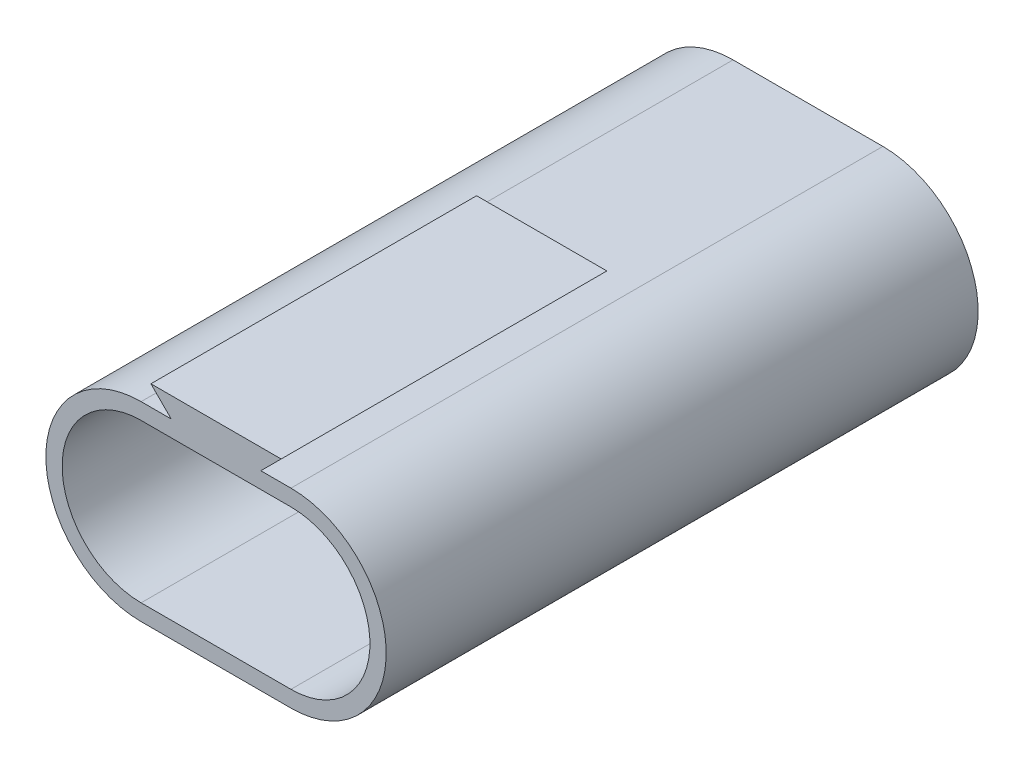
from build123d import *

# Parameters (mm, degrees)
Y_KSEKLIK_EKSTR_ZYON1_DEPTH = 70.2
Y_KSEKLIK_EKSTR_ZYON2_START = 2.5
Y_KSEKLIK_EKSTR_ZYON2_DEPTH = 2.5
Y_KSEKLIK_EKSTR_ZYON5_DEPTH = 40
PAH1_SIZE                   = 2.5
KES_EKSTR_ZYON1_DEPTH       = 10


with BuildPart() as part:
    # Çizim1 → Yükseklik-Ekstrüzyon1 (new body)
    with BuildSketch(Plane.XY):
        with BuildLine():
            Line((0, 11.7), (18.4, 11.7))
            ThreePointArc((18.4, 11.7), (30.1, 0), (18.4, -11.7))
            Line((18.4, -11.7), (0, -11.7))
            ThreePointArc((0, -11.7), (-11.7, 0), (0, 11.7))
        make_face()
        with BuildLine():
            ThreePointArc((0, 9.7), (-9.7, 0), (0, -9.7))
            Line((0, -9.7), (18.4, -9.7))
            ThreePointArc((18.4, -9.7), (28.1, 0), (18.4, 9.7))
            Line((18.4, 9.7), (0, 9.7))
        make_face(mode=Mode.SUBTRACT)
    extrude(amount=Y_KSEKLIK_EKSTR_ZYON1_DEPTH)

    # Çizim2 → Yükseklik-Ekstrüzyon2 (add)
    with BuildSketch(Plane(origin=(0, 0, 0), x_dir=(-1, 0, 0), z_dir=(0, 0, -1)).offset(Y_KSEKLIK_EKSTR_ZYON2_START)):
        with BuildLine():
            Line((0, 11.7), (-18.4, 11.7))
            ThreePointArc((-18.4, 11.7), (-30.1, 0), (-18.4, -11.7))
            Line((-18.4, -11.7), (0, -11.7))
            ThreePointArc((0, -11.7), (11.7, 0), (0, 11.7))
        make_face()
    extrude(amount=-Y_KSEKLIK_EKSTR_ZYON2_DEPTH)

    # Çizim8 → Yükseklik-Ekstrüzyon5 (add)
    with BuildSketch(Plane.XY.offset(70.2)):
        Polygon((14.7, 11.7), (3.7, 11.7), (1.2, 14.2), (17.2, 14.2), align=None)
    extrude(amount=-Y_KSEKLIK_EKSTR_ZYON5_DEPTH)

    # Pah1
    pah1_edges = [part.edges().sort_by_distance(p)[0] for p in [
        (9.2, 11.7, 30.2),
    ]]
    chamfer(pah1_edges, length=PAH1_SIZE - 0.0001)  # a hair under: the kernel refuses the full size

    # Çizim9 → Kes-Ekstrüzyon1 (cut)
    with BuildSketch(Plane(origin=(0, 0, -2.5), x_dir=(-1, 0, 0), z_dir=(0, 0, -1))):
        with BuildLine():
            Line((0, -3), (-18.4, -3))
            ThreePointArc((-18.4, -3), (-21.4, 0), (-18.4, 3))
            Line((-18.4, 3), (0, 3))
            ThreePointArc((0, 3), (3, 0), (0, -3))
        make_face()
    extrude(amount=-KES_EKSTR_ZYON1_DEPTH, mode=Mode.SUBTRACT)


solid = part.part
